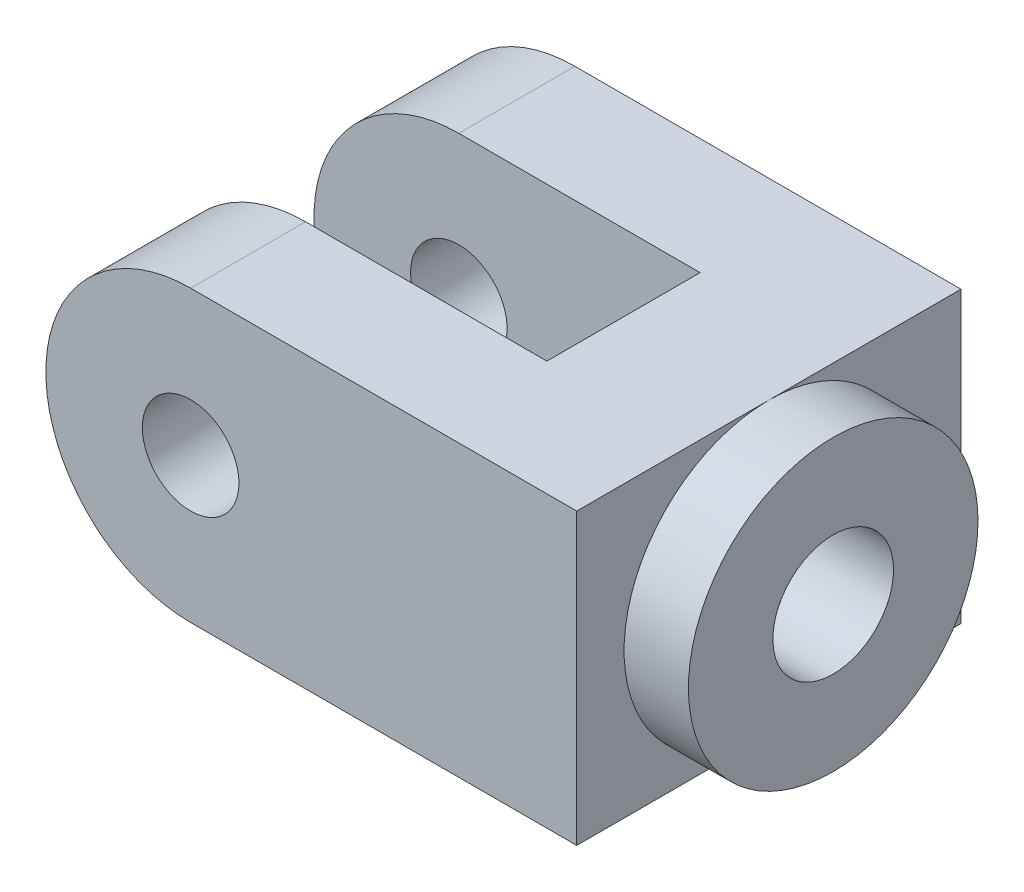
from build123d import *

# Parameters (mm, degrees)
SKETCH1_W           = 132
SKETCH1_H           = 72
BOSS_EXTRUDE1_DEPTH = 95.55
CUT_EXTRUDE3_START  = -95.55
CUT_EXTRUDE3_DEPTH  = 95.55
SKETCH3_W           = 96
SKETCH3_H           = 38.1
CUT_EXTRUDE4_DEPTH  = 137.637485706
SKETCH4_R           = 15
CUT_EXTRUDE5_DEPTH  = 167.88260095
BOSS_EXTRUDE2_START = 16
SKETCH5_R           = 36
SKETCH5_R_2         = 15
BOSS_EXTRUDE2_DEPTH = 16
SKETCH6_R           = 12
CUT_EXTRUDE6_DEPTH  = 131.957254476


# Read off the part's stored shape, not the designer's step: Cut-Extrude3
with BuildPart() as part:
    # Sketch1 → Boss-Extrude1 (new body)
    with BuildSketch(Plane.XY):
        Rectangle(SKETCH1_W, SKETCH1_H)
    extrude(amount=BOSS_EXTRUDE1_DEPTH)

    # Cut-Extrude3 outline → Cut-Extrude3 (cut)
    with BuildSketch(Plane.XY.offset(95.55).offset(CUT_EXTRUDE3_START)):
        with BuildLine():
            Line((-66, -36), (-30, -36))
            ThreePointArc((-30, -36), (-55.455844123, -25.455844123), (-66, 0))
            Line((-66, 0), (-66, -36))
        make_face()
        with BuildLine():
            Line((-66, 36), (-66, 0))
            ThreePointArc((-66, 0), (-55.455844123, 25.455844123), (-30, 36))
            Line((-30, 36), (-66, 36))
        make_face()
    extrude(amount=CUT_EXTRUDE3_DEPTH, mode=Mode.SUBTRACT)

    # Sketch3 → Cut-Extrude4 (cut, through all)
    with BuildSketch(Plane(origin=(0, 36, 0), x_dir=(1, 0, 0), z_dir=(0, 1, 0))):
        with Locations((-18, -47.92)):
            Rectangle(SKETCH3_W, SKETCH3_H)
    extrude(amount=-CUT_EXTRUDE4_DEPTH, mode=Mode.SUBTRACT)

    # Sketch4 → Cut-Extrude5 (cut, through all)
    with BuildSketch(Plane(origin=(66, 0, 0), x_dir=(0, 0, -1), z_dir=(1, 0, 0))):
        with Locations((-47.775, 0)):
            Circle(SKETCH4_R)
    extrude(amount=-CUT_EXTRUDE5_DEPTH, mode=Mode.SUBTRACT)

    # Sketch5 → Boss-Extrude2 (add)
    with BuildSketch(Plane(origin=(66, 0, 0), x_dir=(0, 0, -1), z_dir=(1, 0, 0)).offset(BOSS_EXTRUDE2_START)):
        with Locations(Location((-47.775, 0, 0), (0, 0, 270))):
            Circle(SKETCH5_R)
        with Locations((-47.775, 0)):
            Circle(SKETCH5_R_2, mode=Mode.SUBTRACT)
    extrude(amount=-BOSS_EXTRUDE2_DEPTH)

    # Sketch6 → Cut-Extrude6 (cut, through all)
    with BuildSketch(Plane(origin=(0, 0, 0), x_dir=(-1, 0, 0), z_dir=(0, 0, -1))):
        with Locations((30, 0)):
            Circle(SKETCH6_R)
    extrude(amount=-CUT_EXTRUDE6_DEPTH, mode=Mode.SUBTRACT)


solid = part.part
